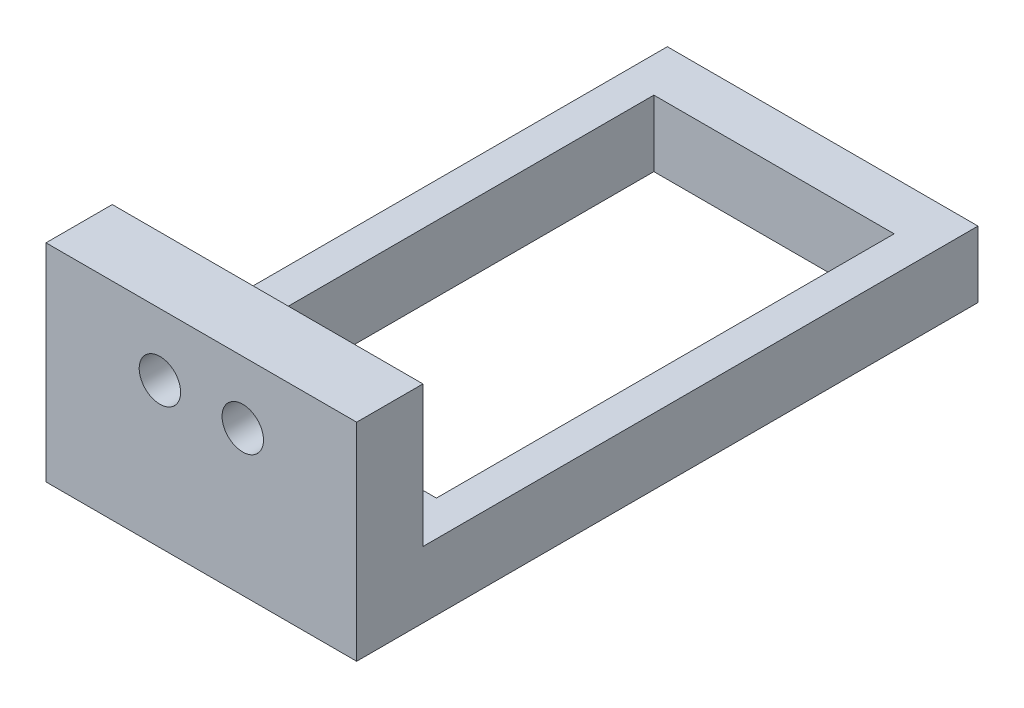
from build123d import *

# Parameters (mm, degrees)
SKETCH1_W           = 15
SKETCH1_H           = 30
BOSS_EXTRUDE1_DEPTH = 10
SKETCH4_W           = 15
SKETCH4_H           = 6.8
CUT_EXTRUDE2_DEPTH  = 26.8
SKETCH5_R           = 1
CUT_EXTRUDE3_DEPTH  = 33.5
SKETCH6_W           = 11.6
SKETCH6_H           = 22.1
CUT_EXTRUDE4_DEPTH  = 19.096684779


with BuildPart() as part:
    # Sketch1 → Boss-Extrude1 (new body)
    with BuildSketch(Plane(origin=(0, 0, 0), x_dir=(1, 0, 0), z_dir=(0, 1, 0))):
        Rectangle(SKETCH1_W, SKETCH1_H)
    extrude(amount=BOSS_EXTRUDE1_DEPTH)

    # Sketch4 → Cut-Extrude2 (cut)
    with BuildSketch(Plane(origin=(0, 0, -15), x_dir=(-1, 0, 0), z_dir=(0, 0, -1))):
        with Locations((0, 6.6)):
            Rectangle(SKETCH4_W, SKETCH4_H)
    extrude(amount=-CUT_EXTRUDE2_DEPTH, mode=Mode.SUBTRACT)

    # Sketch5 → Cut-Extrude3 (cut, through all)
    with BuildSketch(Plane.XY.offset(15)):
        with Locations((-2, 7)):
            Circle(SKETCH5_R)
        with Locations((2, 7)):
            Circle(SKETCH5_R)
    extrude(amount=-CUT_EXTRUDE3_DEPTH, mode=Mode.SUBTRACT)

    # Sketch6 → Cut-Extrude4 (cut, through all)
    with BuildSketch(Plane(origin=(0, 3.2, 0), x_dir=(1, 0, 0), z_dir=(0, 1, 0))):
        with Locations((0, 1.6)):
            Rectangle(SKETCH6_W, SKETCH6_H)
    extrude(amount=-CUT_EXTRUDE4_DEPTH, mode=Mode.SUBTRACT)


solid = part.part
